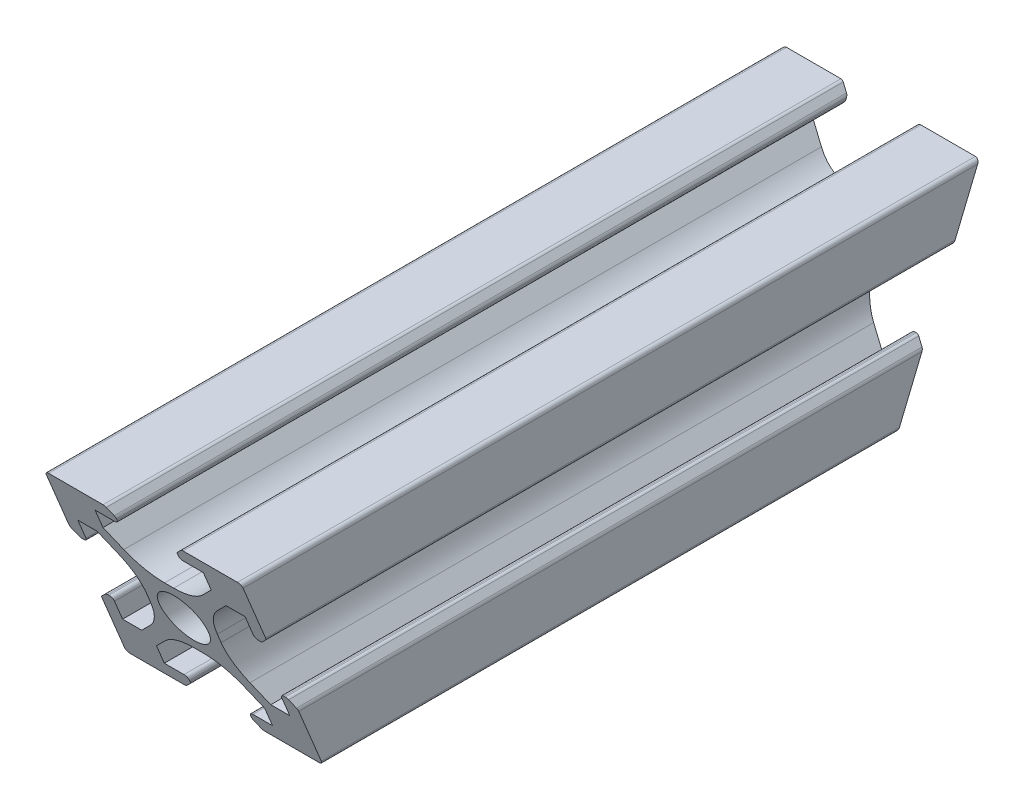
from build123d import *

# Parameters (mm, degrees)
RESSALTO_EXTRUS_O1_DEPTH = 75
PADR_OCIRCULAR1_COUNT    = 4
FILETE1_R                = 0.4
CUT_EXTRUDE1_DEPTH       = 79.262379212


with BuildPart() as part:
    # Esboço1 → Ressalto-extrusão1 (new body)
    with BuildSketch(Plane.XY):
        with BuildLine():
            ThreePointArc((-9.317157288, 3.217157288), (-9.187387948, 3.130448187), (-9.034314575, 3.1))
            Line((-9.034314575, 3.1), (-8.9, 3.1))
            ThreePointArc((-8.9, 3.1), (-8.617157288, 3.217157288), (-8.5, 3.5))
            Line((-8.5, 3.5), (-8.5, 5.5))
            Line((-8.5, 5.5), (-6.560660172, 5.5))
            Line((-6.560660172, 5.5), (-5.064466094, 4.003805922))
            ThreePointArc((-5.064466094, 4.003805922), (-3.980602337, 2.381689178), (-3.6, 0.468272016))
            Line((-3.6, 0.468272016), (-3.6, 0))
            Line((-3.6, 0), (-2.5, 0))
            ThreePointArc((-2.5, 0), (-1.767766953, 1.767766953), (0, 2.5))
            Line((0, 2.5), (0, 3.6))
            Line((0, 3.6), (-0.468272016, 3.6))
            ThreePointArc((-0.468272016, 3.6), (-2.381689178, 3.980602337), (-4.003805922, 5.064466094))
            Line((-4.003805922, 5.064466094), (-5.5, 6.560660172))
            Line((-5.5, 6.560660172), (-5.5, 8.5))
            Line((-5.5, 8.5), (-3.5, 8.5))
            ThreePointArc((-3.5, 8.5), (-3.217157288, 8.617157288), (-3.1, 8.9))
            Line((-3.1, 8.9), (-3.1, 9.034314575))
            ThreePointArc((-3.1, 9.034314575), (-3.130448187, 9.187387948), (-3.217157288, 9.317157288))
            Line((-3.217157288, 9.317157288), (-3.782842712, 9.882842712))
            ThreePointArc((-3.782842712, 9.882842712), (-3.912612052, 9.969551813), (-4.065685425, 10))
            Line((-4.065685425, 10), (-10, 10))
            Line((-10, 10), (-10, 4.065685425))
            ThreePointArc((-10, 4.065685425), (-9.969551813, 3.912612052), (-9.882842712, 3.782842712))
            Line((-9.882842712, 3.782842712), (-9.317157288, 3.217157288))
        make_face()
    ressalto_extrus_o1 = extrude(amount=RESSALTO_EXTRUS_O1_DEPTH)

    # PadrãoCircular1: Ressalto-extrusão1 ×4 about axis
    padr_ocircular1_axis = Axis((0, 0, 0), (0, 0, 1))
    for i in range(1, PADR_OCIRCULAR1_COUNT):
        add(ressalto_extrus_o1.rotate(padr_ocircular1_axis, i * 360 / PADR_OCIRCULAR1_COUNT))

    # Filete1
    filete1_edges = [part.edges().sort_by_distance(p)[0] for p in [
        (-10, -10, 37.5),
        (-10, 10, 37.5),
        (10, -10, 37.5),
        (10, 10, 37.5),
    ]]
    fillet(filete1_edges, radius=FILETE1_R)

    # Sketch1 → Cut-Extrude1 (cut, through all)
    with BuildSketch(Plane.ZY.offset(10)):
        Polygon((0, 10), (0, -10), (8.284271247, -10), align=None)
        Polygon((75, 10), (66.715728753, -10), (75, -10), align=None)
    extrude(amount=-CUT_EXTRUDE1_DEPTH, mode=Mode.SUBTRACT)


solid = part.part
